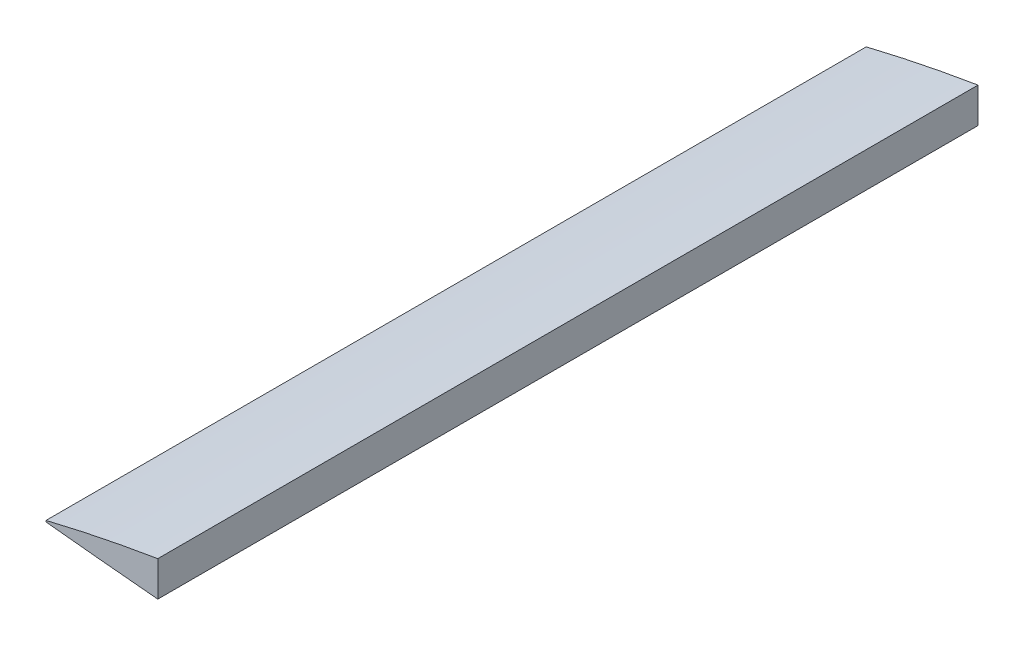
from build123d import *

# Parameters (mm, degrees)
BOSS_EXTRUDE1_DEPTH = 612
SKETCH2_W           = 21
SKETCH2_H           = 11.5
CUT_EXTRUDE1_DEPTH  = 13


with BuildPart() as part:
    # Sketch1 → Boss-Extrude1 (new body)
    with BuildSketch(Plane.XY):
        with BuildLine():
            Line((-237.3661, 17.502280368), (-237.3661, -8.674289956))
            add(Edge.make_bspline(
                [(-237.3661, -8.674289956), (-239.475083316, -8.483098289), (-245.080837993, -7.974903856), (-253.991881888, -7.146922519), (-263.889008858, -6.214616162), (-273.154176998, -5.32687884), (-281.728490591, -4.49257301), (-289.557033039, -3.71898722), (-296.589425041, -3.013864946), (-302.78010049, -2.383682538), (-308.088897631, -1.837830744), (-312.480728812, -1.376034218), (-315.927726107, -1.022678485), (-318.404741576, -0.737439563), (-319.900347138, -0.617044832), (-320.574918687, -0.50340935), (-320.753795962, -0.504046046), (-320.765, -0.504085926)],
                knots=[0, 0, 0, 0, 0.075810952, 0.201508279, 0.320388141, 0.43169539, 0.534719075, 0.628797147, 0.713321079, 0.787740393, 0.851567051, 0.904379655, 0.945827345, 0.975633259, 0.993597432, 0.999598973, 1, 1, 1, 1], degree=3))
            Line((-320.765, -0.504085926), (-320.765, 0.512293238))
            add(Edge.make_bspline(
                [(-237.3661, 17.502280368), (-239.80186616, 17.098302008), (-245.728570145, 16.115342236), (-254.934959794, 14.475311701), (-264.776350168, 12.647435041), (-273.967245237, 10.858568398), (-282.453543525, 9.139266434), (-290.184778643, 7.514392277), (-297.115470623, 6.009399781), (-303.205072817, 4.648335133), (-308.418205135, 3.453718605), (-312.72476491, 2.445888541), (-316.100039766, 1.642515192), (-318.524733585, 1.057899144), (-319.973889731, 0.705575825), (-320.613290589, 0.549358599), (-320.765, 0.512293238)],
                knots=[0, 0, 0, 0, 0.087007005, 0.211705365, 0.329527113, 0.439740645, 0.541660709, 0.634652346, 0.718134669, 0.791584505, 0.854539888, 0.906603358, 0.947445002, 0.976805146, 0.994496602, 1, 1, 1, 1], degree=3))
        make_face()
    extrude(amount=-BOSS_EXTRUDE1_DEPTH)

    # Sketch2 → Cut-Extrude1 (cut)
    with BuildSketch(Plane.XY.offset(-96.9)):
        with Locations((-250.574, -3.303)):
            Rectangle(SKETCH2_W, SKETCH2_H)
    extrude(amount=CUT_EXTRUDE1_DEPTH, mode=Mode.SUBTRACT)


solid = part.part
